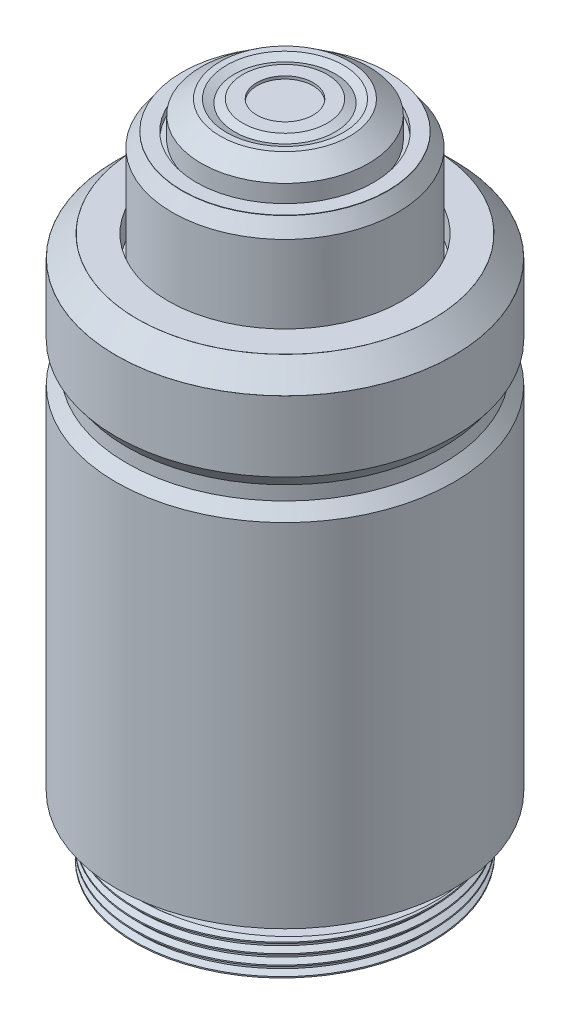
from build123d import *

# Parameters (mm, degrees)
CROQUIS1_R               = 12
SALIENTE_EXTRUIR1_DEPTH  = 25
CROQUIS3_R               = 11.25
SALIENTE_EXTRUIR2_DEPTH  = 2.8
CROQUIS5_R               = 12
SALIENTE_EXTRUIR3_DEPTH  = 5
CROQUIS7_R               = 10.5
SALIENTE_EXTRUIR4_DEPTH  = 1.5
CROQUIS9_R               = 8.3
CORTAR_EXTRUIR1_DEPTH    = 2
CROQUIS10_R              = 8
SALIENTE_EXTRUIR5_DEPTH  = 7.3
CROQUIS11_R              = 7.3
SALIENTE_EXTRUIR6_DEPTH  = 1
CROQUIS13_R              = 6.3
CORTAR_EXTRUIR2_DEPTH    = 0.5
CROQUIS14_R              = 5.95
SALIENTE_EXTRUIR7_DEPTH  = 1.5
CROQUIS15_R              = 4.6
SALIENTE_EXTRUIR8_DEPTH  = 1
CROQUIS17_R              = 4.15
CORTAR_EXTRUIR3_DEPTH    = 0.25
CROQUIS22_R              = 3
SALIENTE_EXTRUIR10_DEPTH = 0.25
CROQUIS24_R              = 10.65
SALIENTE_EXTRUIR11_DEPTH = 0.5
CROQUIS26_R              = 9.5
SALIENTE_EXTRUIR12_DEPTH = 1.2
CROQUIS27_R              = 10.16
SALIENTE_EXTRUIR13_DEPTH = 2.6
CROQUIS28_R              = 9.45
CROQUIS28_R_2            = 7.5
SALIENTE_EXTRUIR14_DEPTH = 0.2
CROQUIS29_R              = 3.75
CORTAR_EXTRUIR4_DEPTH    = 36.6
CROQUIS30_R              = 2
CORTAR_EXTRUIR5_DEPTH    = 40.2
CROQUIS31_R              = 3.748439465
SALIENTE_EXTRUIR15_DEPTH = 2
CROQUIS32_R              = 2
SALIENTE_EXTRUIR20_DEPTH = 0.5
CROQUIS33_R              = 2.002054115
SALIENTE_EXTRUIR21_DEPTH = 2.7
CROQUIS34_R              = 2.002054115
CORTAR_EXTRUIR7_DEPTH    = 0.7
ROSCA2_PITCH             = 0.705555556
ROSCA2_FROM              = 0.6
ROSCA2_TO                = 3.2


with BuildPart() as part:
    # Croquis1 → Saliente-Extruir1 (new body)
    with BuildSketch(Plane(origin=(0, 0, 0), x_dir=(1, 0, 0), z_dir=(0, 1, 0))):
        with Locations(Location((0, 0, 0), (0, 0, 270))):
            Circle(CROQUIS1_R)
    extrude(amount=SALIENTE_EXTRUIR1_DEPTH)

    # Croquis3 → Saliente-Extruir2 (add)
    with BuildSketch(Plane(origin=(0, 25, 0), x_dir=(1, 0, 0), z_dir=(0, 1, 0))):
        with Locations(Location((0, 0, 0), (0, 0, 270))):
            Circle(CROQUIS3_R)
    extrude(amount=SALIENTE_EXTRUIR2_DEPTH)

    # Croquis4 → Revolución1 (revolve)
    with BuildSketch(Plane.XY, mode=Mode.PRIVATE) as revoluci_n1_sk:
        Polygon((-11.25, 25.8), (-12, 25), (-11.25, 25), (0, 25), (0, 25.8), align=None)
    revolve(revoluci_n1_sk.sketch.rotate(Axis((0, 25.8, 0), (0, -1, 0)), 270), axis=Axis((0, 25.8, 0), (0, -1, 0)))

    # Croquis5 → Saliente-Extruir3 (add)
    with BuildSketch(Plane(origin=(0, 27.8, 0), x_dir=(1, 0, 0), z_dir=(0, 1, 0))):
        with Locations(Location((0, 0, 0), (0, 0, 270))):
            Circle(CROQUIS5_R)
    extrude(amount=SALIENTE_EXTRUIR3_DEPTH)

    # Croquis6 → Revolución2 (revolve)
    with BuildSketch(Plane(origin=(0, 0, 0), x_dir=(0, 0, -1), z_dir=(1, 0, 0))):
        Polygon((-11.25, 26.8), (-12, 27.8), (-11.25, 27.8), (0, 27.8), (0, 26.8), align=None)
    revolve(axis=Axis((0, 27.8, 0), (0, -1, 0)))

    # Croquis7 → Saliente-Extruir4 (add)
    with BuildSketch(Plane(origin=(0, 32.8, 0), x_dir=(1, 0, 0), z_dir=(0, 1, 0))):
        with Locations(Location((0, 0, 0), (0, 0, 270))):
            Circle(CROQUIS7_R)
    extrude(amount=SALIENTE_EXTRUIR4_DEPTH)

    # Croquis8 → Revolución3 (revolve)
    with BuildSketch(Plane(origin=(0, 0, 0), x_dir=(0, 0, -1), z_dir=(1, 0, 0)), mode=Mode.PRIVATE) as revoluci_n3_sk:
        Polygon((-11.993760194, 32.8), (-10.493760194, 34.3), (0, 34.3), (0, 32.8), align=None)
    revolve(revoluci_n3_sk.sketch.rotate(Axis((0, 34.3, 0), (0, -1, 0)), 180), axis=Axis((0, 34.3, 0), (0, -1, 0)))

    # Croquis9 → Cortar-Extruir1 (cut)
    with BuildSketch(Plane(origin=(0, 34.3, 0), x_dir=(1, 0, 0), z_dir=(0, 1, 0))):
        with Locations(Location((0, 0, 0), (0, 0, 270))):
            Circle(CROQUIS9_R)
    extrude(amount=-CORTAR_EXTRUIR1_DEPTH, mode=Mode.SUBTRACT)

    # Croquis10 → Saliente-Extruir5 (add)
    with BuildSketch(Plane(origin=(0, 32.3, 0), x_dir=(1, 0, 0), z_dir=(0, 1, 0))):
        with Locations(Location((0, 0, 0), (0, 0, 270))):
            Circle(CROQUIS10_R)
    extrude(amount=SALIENTE_EXTRUIR5_DEPTH)

    # Croquis11 → Saliente-Extruir6 (add)
    with BuildSketch(Plane(origin=(0, 39.6, 0), x_dir=(1, 0, 0), z_dir=(0, 1, 0))):
        with Locations(Location((0, 0, 0), (0, 0, 270))):
            Circle(CROQUIS11_R)
    extrude(amount=SALIENTE_EXTRUIR6_DEPTH)

    # Croquis12 → Revolución4 (revolve)
    with BuildSketch(Plane(origin=(0, 0, 0), x_dir=(0, 0, -1), z_dir=(1, 0, 0)), mode=Mode.PRIVATE) as revoluci_n4_sk:
        Polygon((-7.280544931, 40.6), (-8, 39.6), (0, 39.6), (0, 40.6), align=None)
    revolve(revoluci_n4_sk.sketch.rotate(Axis((0, 39.6, 0), (0, 1, 0)), 180), axis=Axis((0, 39.6, 0), (0, 1, 0)))

    # Croquis13 → Cortar-Extruir2 (cut)
    with BuildSketch(Plane(origin=(0, 40.6, 0), x_dir=(1, 0, 0), z_dir=(0, 1, 0))):
        with Locations(Location((0, 0, 0), (0, 0, 270))):
            Circle(CROQUIS13_R)
    extrude(amount=-CORTAR_EXTRUIR2_DEPTH, mode=Mode.SUBTRACT)

    # Croquis14 → Saliente-Extruir7 (add)
    with BuildSketch(Plane(origin=(0, 40.1, 0), x_dir=(1, 0, 0), z_dir=(0, 1, 0))):
        with Locations(Location((0, 0, 0), (0, 0, 270))):
            Circle(CROQUIS14_R)
    extrude(amount=SALIENTE_EXTRUIR7_DEPTH)

    # Croquis15 → Saliente-Extruir8 (add)
    with BuildSketch(Plane(origin=(0, 41.6, 0), x_dir=(1, 0, 0), z_dir=(0, 1, 0))):
        with Locations(Location((0, 0, 0), (0, 0, 270))):
            Circle(CROQUIS15_R)
    extrude(amount=SALIENTE_EXTRUIR8_DEPTH)

    # Croquis16 → Revolución5 (revolve)
    with BuildSketch(Plane(origin=(0, 0, 0), x_dir=(0, 0, -1), z_dir=(1, 0, 0)), mode=Mode.PRIVATE) as revoluci_n5_sk:
        Polygon((-5.95, 41.6), (-4.6, 42.6), (0, 42.6), (0, 41.6), align=None)
    revolve(revoluci_n5_sk.sketch.rotate(Axis((0, 42.6, 0), (0, -1, 0)), 180), axis=Axis((0, 42.6, 0), (0, -1, 0)))

    # Croquis17 → Cortar-Extruir3 (cut)
    with BuildSketch(Plane(origin=(0, 42.6, 0), x_dir=(1, 0, 0), z_dir=(0, 1, 0))):
        with Locations(Location((0, 0, 0), (0, 0, 270))):
            Circle(CROQUIS17_R)
    extrude(amount=-CORTAR_EXTRUIR3_DEPTH, mode=Mode.SUBTRACT)

    # Croquis21 → Revolución8 (revolve)
    with BuildSketch(Plane.XY, mode=Mode.PRIVATE) as revoluci_n8_sk:
        Polygon((0, 42.35), (3.575, 42.35), (4.15, 42.6), (4.15, 41.766499738), (0, 41.766499738), align=None)
    revolve(revoluci_n8_sk.sketch.rotate(Axis((0, 41.766499738, 0), (0, 1, 0)), 90), axis=Axis((0, 41.766499738, 0), (0, 1, 0)))

    # Croquis22 → Saliente-Extruir10 (add)
    with BuildSketch(Plane(origin=(0, 42.35, 0), x_dir=(1, 0, 0), z_dir=(0, 1, 0))):
        with Locations(Location((0, 0, 0), (0, 0, 270))):
            Circle(CROQUIS22_R)
    extrude(amount=SALIENTE_EXTRUIR10_DEPTH)

    # Croquis23 → Revolución9 (revolve)
    with BuildSketch(Plane.XY, mode=Mode.PRIVATE) as revoluci_n9_sk:
        Polygon((3, 42.6), (3.575, 42.35), (0, 42.35), (0, 42.6), align=None)
    revolve(revoluci_n9_sk.sketch.rotate(Axis((0, 42.35, 0), (0, 1, 0)), 90), axis=Axis((0, 42.35, 0), (0, 1, 0)))

    # Croquis24 → Saliente-Extruir11 (add)
    with BuildSketch(Plane.XZ):
        with Locations(Location((0, 0, 0), (0, 0, 270))):
            Circle(CROQUIS24_R)
    extrude(amount=SALIENTE_EXTRUIR11_DEPTH)

    # Croquis25 → Revolución10 (revolve)
    with BuildSketch(Plane(origin=(0, 0, 0), x_dir=(0, 0, -1), z_dir=(1, 0, 0))):
        Polygon((12, 0), (10.65, -0.5), (0, -0.5), (0, 0), align=None)
    revolve(axis=Axis((0, -0.5, 0), (0, 1, 0)))

    # Croquis26 → Saliente-Extruir12 (add)
    with BuildSketch(Plane.XZ.offset(0.5)):
        with Locations(Location((0, 0, 0), (0, 0, 270))):
            Circle(CROQUIS26_R)
    extrude(amount=SALIENTE_EXTRUIR12_DEPTH)

    # Croquis27 → Saliente-Extruir13 (add)
    with BuildSketch(Plane.XZ.offset(1.7)):
        with Locations(Location((0, 0, 0), (0, 0, 270))):
            Circle(CROQUIS27_R)
    extrude(amount=SALIENTE_EXTRUIR13_DEPTH)

    # Croquis28 → Saliente-Extruir14 (add)
    with BuildSketch(Plane.XZ.offset(4.3)):
        with Locations(Location((0, 0, 0), (0, 0, 270))):
            Circle(CROQUIS28_R)
        with Locations(Location((0, 0, 0), (0, 0, 270))):
            Circle(CROQUIS28_R_2, mode=Mode.SUBTRACT)
    extrude(amount=SALIENTE_EXTRUIR14_DEPTH)

    # Croquis29 → Cortar-Extruir4 (cut)
    with BuildSketch(Plane.XZ.offset(4.3)):
        with Locations(Location((0, 0, 0), (0, 0, 270))):
            Circle(CROQUIS29_R)
    extrude(amount=-CORTAR_EXTRUIR4_DEPTH, mode=Mode.SUBTRACT)

    # Croquis30 → Cortar-Extruir5 (cut)
    with BuildSketch(Plane(origin=(0, 42.6, 0), x_dir=(1, 0, 0), z_dir=(0, 1, 0))):
        with Locations(Location((0, 0, 0), (0, 0, 270))):
            Circle(CROQUIS30_R)
    extrude(amount=-CORTAR_EXTRUIR5_DEPTH, mode=Mode.SUBTRACT)



with BuildPart() as body_2:
    # Croquis31 → Saliente-Extruir15 (new body)
    with BuildSketch(Plane.XZ.offset(4.3)):
        with Locations(Location((0, 0, 0), (0, 0, 270))):
            Circle(CROQUIS31_R)
    extrude(amount=-SALIENTE_EXTRUIR15_DEPTH)


with BuildPart() as body_3:
    # Croquis32 → Saliente-Extruir20 (new body)
    with BuildSketch(Plane(origin=(0, 42.6, 0), x_dir=(1, 0, 0), z_dir=(0, 1, 0))):
        with Locations(Location((0, 0, 0), (0, 0, 270))):
            Circle(CROQUIS32_R)
    extrude(amount=SALIENTE_EXTRUIR20_DEPTH)


with BuildPart() as part_1:
    add(part.part)

    add(body_3.part)  # Saliente-Extruir21 merges body 3
    # Croquis33 → Saliente-Extruir21 (add)
    with BuildSketch(Plane(origin=(0, 43.1, 0), x_dir=(1, 0, 0), z_dir=(0, 1, 0))):
        with Locations(Location((0, 0, 0), (0, 0, 270))):
            Circle(CROQUIS33_R)
    extrude(amount=-SALIENTE_EXTRUIR21_DEPTH)

    # Croquis34 → Cortar-Extruir7 (cut)
    with BuildSketch(Plane(origin=(0, 43.1, 0), x_dir=(1, 0, 0), z_dir=(0, 1, 0))):
        with Locations(Location((0, 0, 0), (0, 0, 270))):
            Circle(CROQUIS34_R)
    extrude(amount=-CORTAR_EXTRUIR7_DEPTH, mode=Mode.SUBTRACT)

    # Rosca2: arcs per turn and ends read off the stored shape
    # Rosca2: the profile of Perfil de rosca3 profile screwed along a right-hand helix through 17.858268 turns, 6 arcs to a turn; built about Z, then put on its axis
    rosca2_z = Axis((0, 0, 0), (0, 0, 1))
    rosca2_corners = [(10.1597, 0, -0.000173205), (10.541893145, 0, 0.22048611), (10.541893145, 0, 0.308680555), (10.1597, 0, 0.52933987)]
    with BuildLine(mode=Mode.PRIVATE) as rosca2_profile:
        Line(rosca2_corners[0], rosca2_corners[1])
        Line(rosca2_corners[1], rosca2_corners[2])
        Line(rosca2_corners[2], rosca2_corners[3])
        Line(rosca2_corners[3], rosca2_corners[0])
    rosca2_cap = Face(rosca2_profile.wire())
    rosca2_turn_angles = [0, 30, 60, 90, 120, 150, 180, 210, 240, 270, 300, 330, 360]
    rosca2_turn_weights = [1, 0.8660254037844387, 1, 0.8660254037844387, 1, 0.8660254037844387, 1, 0.8660254037844387, 1, 0.8660254037844387, 1, 0.8660254037844387, 1]
    rosca2_turn_rails = [Edge.make_bspline([Vector(p[0], p[1], 0).rotate(rosca2_z, rosca2_turn_angles[k]) / rosca2_turn_weights[k] + Vector(0, 0, p[2] + ROSCA2_PITCH * rosca2_turn_angles[k] / 360) for k in range(13)], [0, 0, 0, 1, 1, 2, 2, 3, 3, 4, 4, 5, 5, 6, 6, 6], 2, rosca2_turn_weights) for p in rosca2_corners]
    rosca2_turn_sides = [Face.make_surface_from_curves(rosca2_turn_rails[p[0]], rosca2_turn_rails[p[1]]) for p in [(0, 1), (1, 2), (2, 3), (3, 0)]]
    rosca2_last_angles = [6120, 6150, 6180, 6210, 6240, 6270, 6300, 6330, 6360, 6390, 6420, 6424.488188976, 6428.976377953]
    rosca2_last_weights = [1, 0.8660254037844387, 1, 0.8660254037844387, 1, 0.8660254037844387, 1, 0.8660254037844387, 1, 0.8660254037844387, 1, 0.9969334862074889, 1]
    rosca2_last_rails = [Edge.make_bspline([Vector(p[0], p[1], 0).rotate(rosca2_z, rosca2_last_angles[k]) / rosca2_last_weights[k] + Vector(0, 0, p[2] + ROSCA2_PITCH * rosca2_last_angles[k] / 360) for k in range(13)], [0, 0, 0, 1, 1, 2, 2, 3, 3, 4, 4, 5, 5, 6, 6, 6], 2, rosca2_last_weights) for p in rosca2_corners]
    rosca2_last_sides = [Face.make_surface_from_curves(rosca2_last_rails[p[0]], rosca2_last_rails[p[1]]) for p in [(0, 1), (1, 2), (2, 3), (3, 0)]]
    rosca2 = Plane(origin=(0, -4.9, 0), x_dir=(1, 0, 0), z_dir=(0, 1, 0)) * split(split(Solid(Shell([*[p.moved(Location((0, 0, ROSCA2_PITCH * i))) for i in range(17) for p in rosca2_turn_sides], *rosca2_last_sides, rosca2_cap, rosca2_cap.rotate(rosca2_z, 6428.976377953).moved(Location((0, 0, ROSCA2_PITCH * 6428.976377953 / 360)))])), bisect_by=Plane.XY.offset(ROSCA2_FROM), keep=Keep.TOP, mode=Mode.PRIVATE), bisect_by=Plane.XY.offset(ROSCA2_TO), keep=Keep.BOTTOM, mode=Mode.PRIVATE)
    add(rosca2)


solid = Compound([body_2.part, part_1.part])
